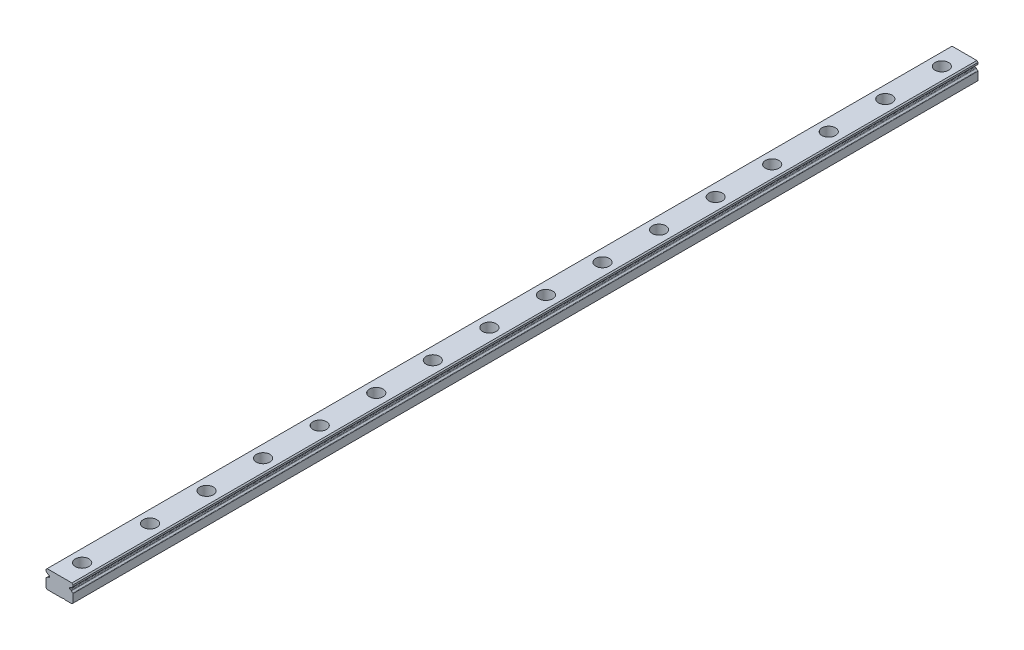
from build123d import *

# Parameters (mm, degrees)
RAIL_PROFILE_DEPTH             = 200
CBORE_FOR_M3_SHCS1_D           = 3.5
CBORE_FOR_M3_SHCS1_CBORE_D     = 6
CBORE_FOR_M3_SHCS1_CBORE_DEPTH = 4.5
FILL_START                     = -2.000000001
FILL_PATTERN1_OUTLINE_R        = 3
FILL_PATTERN1_DEPTH            = 4.5
FILL_START_2                   = -5.5
FILL_PATTERN1_2_OUTLINE_R      = 1.75
FILL_PATTERN1_2_DEPTH          = 3.499999999


# Read off the part's stored shape, not the designer's step: Fill Pattern1
with BuildPart() as part:
    # Sketch1 → RAIL PROFILE (new, symmetric)
    with BuildSketch(Plane.XY):
        with BuildLine():
            Line((-5.982334879, -1.370069213), (-5.982334879, -5.001472146))
            Line((-5.982334879, -5.001472146), (-5.483807025, -5.499999999))
            Line((-5.483807025, -5.499999999), (1.595289228, -5.499999999))
            ThreePointArc((1.595289228, -5.499999999), (1.994111552, -5.300588838), (2.392933875, -5.5))
            Line((2.392933875, -5.5), (5.483807024, -5.5))
            Line((5.483807024, -5.5), (5.982334878, -5.001472147))
            Line((5.982334878, -5.001472147), (5.982334878, -1.370069213))
            ThreePointArc((5.982334878, -1.370069213), (5.940056641, -1.231182813), (5.82756375, -1.139410101))
            ThreePointArc((5.82756375, -1.139410101), (5.497041405, -0.930122348), (5.251697363, -0.625405104))
            ThreePointArc((5.251697363, -0.625405104), (5.169975597, -0.541388466), (5.058890009, -0.504008866))
            Line((5.058890009, -0.504008866), (4.71429032, -0.473860299))
            ThreePointArc((4.71429032, -0.473860299), (4.552238438, -0.393945155), (4.486751147, -0.225544865))
            Line((4.486751147, -0.225544865), (4.486751147, 0.225544865))
            ThreePointArc((4.486751147, 0.225544865), (4.552238438, 0.393945155), (4.71429032, 0.473860299))
            Line((4.71429032, 0.473860299), (5.079776582, 0.505836204))
            ThreePointArc((5.079776582, 0.505836204), (5.187925163, 0.5413949), (5.268982803, 0.621333598))
            ThreePointArc((5.268982803, 0.621333598), (5.511607978, 0.899707672), (5.82756375, 1.09083865))
            ThreePointArc((5.82756375, 1.09083865), (5.940040963, 1.182638806), (5.982312115, 1.321532803))
            Line((5.982312115, 1.321532803), (5.982321902, 2.00145917))
            Line((5.982321902, 2.00145917), (5.483807025, 2.499999999))
            Line((5.483807025, 2.499999999), (-5.483807026, 2.499999999))
            Line((-5.483807026, 2.499999999), (-5.982321903, 2.00145917))
            Line((-5.982321903, 2.00145917), (-5.982321903, 1.32884687))
            ThreePointArc((-5.982321903, 1.32884687), (-5.942177076, 1.185718341), (-5.827697321, 1.090893402))
            ThreePointArc((-5.827697321, 1.090893402), (-5.511663234, 0.899754111), (-5.268982805, 0.621333597))
            ThreePointArc((-5.268982805, 0.621333597), (-5.187925164, 0.541394898), (-5.079776582, 0.505836204))
            Line((-5.079776582, 0.505836204), (-4.71429032, 0.473860299))
            ThreePointArc((-4.71429032, 0.473860299), (-4.552238438, 0.393945155), (-4.486751147, 0.225544865))
            Line((-4.486751147, 0.225544865), (-4.486751147, -0.225544865))
            ThreePointArc((-4.486751147, -0.225544865), (-4.552238438, -0.393945155), (-4.71429032, -0.473860299))
            Line((-4.71429032, -0.473860299), (-5.058890009, -0.504008866))
            ThreePointArc((-5.058890009, -0.504008866), (-5.169975597, -0.541388466), (-5.251697363, -0.625405104))
            ThreePointArc((-5.251697363, -0.625405104), (-5.499180752, -0.921502608), (-5.828043428, -1.123421157))
            ThreePointArc((-5.828043428, -1.123421157), (-5.944906256, -1.221900029), (-5.982334879, -1.370069213))
        make_face()
    extrude(amount=RAIL_PROFILE_DEPTH, both=True)

    # CBORE for M3 SHCS1 (through all)
    with Locations(Plane(origin=(0, 2.499999999, 0), x_dir=(1, 0, 0), z_dir=(0, 1, 0))):
        with Locations((0, 190)):
            cbore_for_m3_shcs1 = CounterBoreHole(CBORE_FOR_M3_SHCS1_D / 2, CBORE_FOR_M3_SHCS1_CBORE_D / 2, CBORE_FOR_M3_SHCS1_CBORE_DEPTH)

    # M3 END MIRROR: CBORE for M3 SHCS1 across plane
    add(cbore_for_m3_shcs1.mirror(Plane.XY), mode=Mode.SUBTRACT)

    # Fill Pattern1 outline → Fill Pattern1 (cut)
    with BuildSketch(Plane(origin=(0, 0, 0), x_dir=(1, 0, 0), z_dir=(0, 1, 0)).offset(FILL_START)):
        with Locations((0, 165)):
            Circle(FILL_PATTERN1_OUTLINE_R)
        with Locations((0, 140)):
            Circle(FILL_PATTERN1_OUTLINE_R)
        with Locations((0, 115)):
            Circle(FILL_PATTERN1_OUTLINE_R)
        with Locations((0, 90)):
            Circle(FILL_PATTERN1_OUTLINE_R)
        with Locations((0, 65)):
            Circle(FILL_PATTERN1_OUTLINE_R)
        with Locations((0, 40)):
            Circle(FILL_PATTERN1_OUTLINE_R)
        with Locations((0, 15)):
            Circle(FILL_PATTERN1_OUTLINE_R)
        with Locations((0, -10)):
            Circle(FILL_PATTERN1_OUTLINE_R)
        with Locations((0, -35)):
            Circle(FILL_PATTERN1_OUTLINE_R)
        with Locations((0, -60)):
            Circle(FILL_PATTERN1_OUTLINE_R)
        with Locations((0, -85)):
            Circle(FILL_PATTERN1_OUTLINE_R)
        with Locations((0, -110)):
            Circle(FILL_PATTERN1_OUTLINE_R)
        with Locations((0, -135)):
            Circle(FILL_PATTERN1_OUTLINE_R)
        with Locations((0, -160)):
            Circle(FILL_PATTERN1_OUTLINE_R)
    extrude(amount=FILL_PATTERN1_DEPTH, mode=Mode.SUBTRACT)

    # Fill Pattern1 2 outline → Fill Pattern1 2 (cut)
    with BuildSketch(Plane(origin=(0, 0, 0), x_dir=(1, 0, 0), z_dir=(0, 1, 0)).offset(FILL_START_2)):
        with Locations((0, 165)):
            Circle(FILL_PATTERN1_2_OUTLINE_R)
        with Locations((0, 140)):
            Circle(FILL_PATTERN1_2_OUTLINE_R)
        with Locations((0, 115)):
            Circle(FILL_PATTERN1_2_OUTLINE_R)
        with Locations((0, 90)):
            Circle(FILL_PATTERN1_2_OUTLINE_R)
        with Locations((0, 65)):
            Circle(FILL_PATTERN1_2_OUTLINE_R)
        with Locations((0, 40)):
            Circle(FILL_PATTERN1_2_OUTLINE_R)
        with Locations((0, 15)):
            Circle(FILL_PATTERN1_2_OUTLINE_R)
        with Locations((0, -10)):
            Circle(FILL_PATTERN1_2_OUTLINE_R)
        with Locations((0, -35)):
            Circle(FILL_PATTERN1_2_OUTLINE_R)
        with Locations((0, -60)):
            Circle(FILL_PATTERN1_2_OUTLINE_R)
        with Locations((0, -85)):
            Circle(FILL_PATTERN1_2_OUTLINE_R)
        with Locations((0, -110)):
            Circle(FILL_PATTERN1_2_OUTLINE_R)
        with Locations((0, -135)):
            Circle(FILL_PATTERN1_2_OUTLINE_R)
        with Locations((0, -160)):
            Circle(FILL_PATTERN1_2_OUTLINE_R)
    extrude(amount=FILL_PATTERN1_2_DEPTH, mode=Mode.SUBTRACT)


solid = part.part
